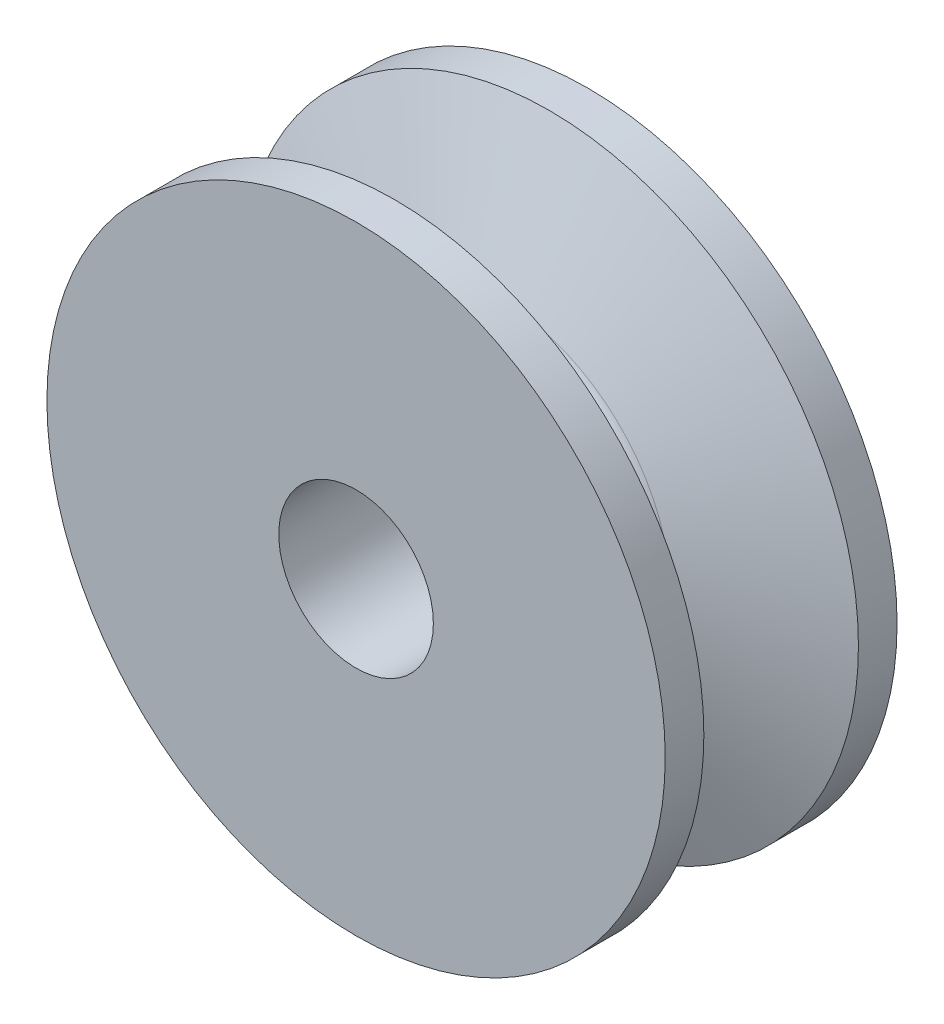
from build123d import *

# Parameters (mm, degrees)
ESQUISSE1_R             = 20
BOSS_EXTRU_1_DEPTH      = 7.5
CONG_1_R                = 1.7
CONG_3_R                = 1.7
ESQUISSE5_R             = 5
ENL_V_MAT_EXTRU_1_DEPTH = 33.015621312


with BuildPart() as part:
    # Esquisse1 → Boss.-Extru.1 (new, symmetric)
    with BuildSketch(Plane.XY):
        Circle(ESQUISSE1_R)
    extrude(amount=BOSS_EXTRU_1_DEPTH, both=True)

    # Esquisse4 → Enlèvement de matière-Révolution1 (revolve, cut)
    with BuildSketch(Plane(origin=(0, 0, 0), x_dir=(0, 0, -1), z_dir=(1, 0, 0))):
        Polygon((-5, 20), (-1.324936438, 10), (1.324936438, 10), (5, 20), align=None)
    revolve(axis=Axis((0, 0, 15.788572615), (0, 0, -1)), mode=Mode.SUBTRACT)

    # Congé1
    cong_1_edges = [part.edges().sort_by_distance(p)[0] for p in [
        (0, -10, -1.324936438),
    ]]
    fillet(cong_1_edges, radius=CONG_1_R)

    # Congé3
    cong_3_edges = [part.edges().sort_by_distance(p)[0] for p in [
        (0, -10, 1.324936438),
    ]]
    fillet(cong_3_edges, radius=CONG_3_R)

    # Esquisse5 → Enlèv. mat.-Extru.1 (cut, through all)
    with BuildSketch(Plane.XY.offset(7.5)):
        Circle(ESQUISSE5_R)
    extrude(amount=-ENL_V_MAT_EXTRU_1_DEPTH, mode=Mode.SUBTRACT)


solid = part.part
